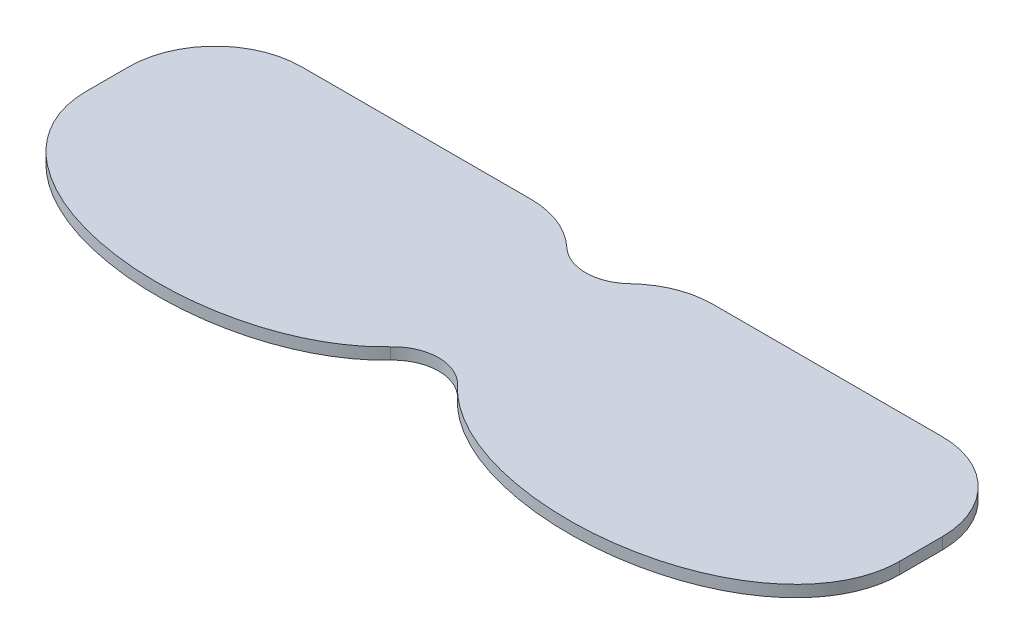
from build123d import *

# Parameters (mm, degrees)
SKETCH4_W                      = 118.3
SKETCH4_H                      = 40.5
BOSS_EXTRUDE1_DEPTH            = 12.7
CUT_EXTRUDE1_DEPTH             = 75.078168174
FILLET1_R                      = 3.175
LPATTERN1_COUNT                = 2
LPATTERN1_PITCH                = 27
FILLET1_OF_LPATTERN1_R         = 3.175
MIRROR1_DEPTH                  = 12.7
SKETCH8_R                      = 0.85
CUT_EXTRUDE2_DEPTH             = 75.078168329
MIRROR3_COPY_1_SKETCH_R        = 0.85
MIRROR3_COPY_1_DEPTH           = 75.078168329
SKETCH14_W                     = 118.3
SKETCH14_H                     = 0.96
SKETCH14_W_2                   = 4.5
SKETCH14_H_2                   = 40.5
CUT_EXTRUDE7_DEPTH             = 0.1
CUT_EXTRUDE8_DEPTH             = 2.35
MIRROR14_COPY_1_DEPTH          = 2.35
MIRROR16_COPY_1_DEPTH          = 2.35
MIRROR16_COPY_2_DEPTH          = 2.35
MIRROR16_COPY_3_DEPTH          = 2.35
CUT_EXTRUDE10_DEPTH            = 75.061089804
SKETCH20_W                     = 127.8
SKETCH20_H                     = 85.5
BOSS_EXTRUDE2_DEPTH            = 3.175
SKETCH22_W                     = 127.8
SKETCH22_H                     = 85.5
CUT_EXTRUDE11_DEPTH            = 78.923440062
CUT_EXTRUDE12_DEPTH            = 77.947080029
F_0_80_TAPPED_HOLE1_D          = 1.19126
MIRROR19_COPY_1_DEPTH          = 77.947080029
MIRROR19_COPY_2_D              = 1.19126
SKETCH26_W                     = 127.8
SKETCH26_H                     = 0.96
CUT_EXTRUDE13_DEPTH            = 3.175
SKETCH27_W                     = 127.8
SKETCH27_H                     = 0.96
CUT_EXTRUDE14_DEPTH            = 3.175
SKETCH29_W                     = 3.175
SKETCH29_H                     = 19.77
CUT_EXTRUDE15_DEPTH            = 0.82
F_0_80_TAPPED_HOLE2_AT_2_COUNT = 2
F_0_80_TAPPED_HOLE2_AT_2_PITCH = 10
SKETCH36_R                     = 0.8
CUT_EXTRUDE16_DEPTH            = 10
FILLET2_R                      = 1.5
FILLET3_R                      = 1.5
F_0_80_TAPPED_HOLE5_AT_2_COUNT = 2
F_0_80_TAPPED_HOLE5_AT_2_PITCH = 10
BOSS_EXTRUDE3_DEPTH            = 0.79375
SKETCH39_W                     = 144.663992048
SKETCH39_H                     = 99.796260463
CUT_EXTRUDE17_DEPTH            = 10
BOSS_EXTRUDE4_DEPTH            = 0.762
SKETCH42_W                     = 65.404927097
SKETCH42_H                     = 32.798348424
CUT_EXTRUDE18_DEPTH            = 10.762


# Read off the part's stored shape, not the designer's step: Mirror1
with BuildPart() as part:
    # Sketch4 → Boss-Extrude1 (new body)
    with BuildSketch(Plane(origin=(0, 0, 0), x_dir=(1, 0, 0), z_dir=(0, 1, 0))):
        with Locations((0, 22.5)):
            Rectangle(SKETCH4_W, SKETCH4_H)
    extrude(amount=BOSS_EXTRUDE1_DEPTH)

    # Sketch5 → Cut-Extrude1 (cut, through all)
    with BuildSketch(Plane(origin=(0, 12.7, 0), x_dir=(1, 0, 0), z_dir=(0, 1, 0))):
        with BuildLine():
            Line((-54.9, 13.5), (-54.9, 7.5))
            Line((-54.9, 7.5), (-33.5, 7.5))
            Line((-33.5, 7.5), (-33.5, 13.5))
            add(Edge.make_bspline(
                [(-33.5, 13.5), (-33.5, 19.5), (-44.2, 19.5), (-54.9, 19.5), (-54.9, 13.5)],
                knots=[3.141592654, 3.141592654, 3.141592654, 4.71238898, 4.71238898, 6.283185307, 6.283185307, 6.283185307], degree=2, weights=[1, 0.707106781, 1, 0.707106781, 1]))
        make_face()
        with BuildLine():
            Line((-54.9, 37.5), (-33.5, 37.5))
            Line((-33.5, 37.5), (-33.5, 31.5))
            add(Edge.make_bspline(
                [(-54.9, 31.5), (-54.9, 25.5), (-44.2, 25.5), (-33.5, 25.5), (-33.5, 31.5)],
                knots=[0, 0, 0, 1.570796327, 1.570796327, 3.141592654, 3.141592654, 3.141592654], degree=2, weights=[1, 0.707106781, 1, 0.707106781, 1]))
            Line((-54.9, 31.5), (-54.9, 37.5))
        make_face()
    cut_extrude1 = extrude(amount=-CUT_EXTRUDE1_DEPTH, mode=Mode.SUBTRACT)

    # Fillet1
    fillet1_edges = [part.edges().sort_by_distance(p)[0] for p in [
        (-33.5, 6.35, -7.5),
        (-54.9, 6.35, -7.5),
        (-54.9, 6.35, -37.5),
        (-33.5, 6.35, -37.5),
    ]]
    fillet(fillet1_edges, radius=FILLET1_R)

    # LPattern1: Cut-Extrude1 ×2
    with Locations(*[(i * LPATTERN1_PITCH, 0, 0) for i in range(1, LPATTERN1_COUNT)]):
        add(cut_extrude1, mode=Mode.SUBTRACT)

    # Fillet1 of LPattern1
    fillet1_of_lpattern1_edges = [part.edges().sort_by_distance(p)[0] for p in [
        (-6.5, 6.35, -7.5),
        (-27.9, 6.35, -7.5),
        (-27.9, 6.35, -37.5),
        (-6.5, 6.35, -37.5),
    ]]
    fillet(fillet1_of_lpattern1_edges, radius=FILLET1_OF_LPATTERN1_R)

    # Mirror1 outline → Mirror1 (cut)
    with BuildSketch(Plane(origin=(0, 0, 0), x_dir=(1, 0, 0), z_dir=(0, 1, 0))):
        with BuildLine():
            add(Edge.make_bspline(
                [(33.5, 13.5), (33.5, 19.5), (44.2, 19.5), (54.9, 19.5), (54.9, 13.5)],
                knots=[3.141592654, 3.141592654, 3.141592654, 4.71238898, 4.71238898, 6.283185307, 6.283185307, 6.283185307], degree=2, weights=[1, 0.707106781, 1, 0.707106781, 1]))
            Line((33.5, 13.5), (33.5, 10.675))
            ThreePointArc((33.5, 10.675), (34.42993597, 8.42993597), (36.675, 7.5))
            Line((36.675, 7.5), (51.725, 7.5))
            ThreePointArc((51.725, 7.5), (53.97006403, 8.42993597), (54.9, 10.675))
            Line((54.9, 10.675), (54.9, 13.5))
        make_face()
        with BuildLine():
            add(Edge.make_bspline(
                [(54.9, 31.5), (54.9, 25.5), (44.2, 25.5), (33.5, 25.5), (33.5, 31.5)],
                knots=[0, 0, 0, 1.570796327, 1.570796327, 3.141592654, 3.141592654, 3.141592654], degree=2, weights=[1, 0.707106781, 1, 0.707106781, 1]))
            Line((54.9, 31.5), (54.9, 34.325))
            ThreePointArc((54.9, 34.325), (53.97006403, 36.57006403), (51.725, 37.5))
            Line((51.725, 37.5), (36.675, 37.5))
            ThreePointArc((36.675, 37.5), (34.42993597, 36.57006403), (33.5, 34.325))
            Line((33.5, 34.325), (33.5, 31.5))
        make_face()
        with BuildLine():
            add(Edge.make_bspline(
                [(6.5, 13.5), (6.5, 19.5), (17.2, 19.5), (27.9, 19.5), (27.9, 13.5)],
                knots=[3.141592654, 3.141592654, 3.141592654, 4.71238898, 4.71238898, 6.283185307, 6.283185307, 6.283185307], degree=2, weights=[1, 0.707106781, 1, 0.707106781, 1]))
            Line((6.5, 13.5), (6.5, 10.675))
            ThreePointArc((6.5, 10.675), (7.42993597, 8.42993597), (9.675, 7.5))
            Line((9.675, 7.5), (24.725, 7.5))
            ThreePointArc((24.725, 7.5), (26.97006403, 8.42993597), (27.9, 10.675))
            Line((27.9, 10.675), (27.9, 13.5))
        make_face()
        with BuildLine():
            add(Edge.make_bspline(
                [(27.9, 31.5), (27.9, 25.5), (17.2, 25.5), (6.5, 25.5), (6.5, 31.5)],
                knots=[0, 0, 0, 1.570796327, 1.570796327, 3.141592654, 3.141592654, 3.141592654], degree=2, weights=[1, 0.707106781, 1, 0.707106781, 1]))
            Line((27.9, 31.5), (27.9, 34.325))
            ThreePointArc((27.9, 34.325), (26.97006403, 36.57006403), (24.725, 37.5))
            Line((24.725, 37.5), (9.675, 37.5))
            ThreePointArc((9.675, 37.5), (7.42993597, 36.57006403), (6.5, 34.325))
            Line((6.5, 34.325), (6.5, 31.5))
        make_face()
    extrude(amount=MIRROR1_DEPTH, mode=Mode.SUBTRACT)

    # Sketch8 → Cut-Extrude2 (cut, through all)
    with BuildSketch(Plane(origin=(0, 12.7, 0), x_dir=(1, 0, 0), z_dir=(0, 1, 0))):
        with Locations(Location((-57.15, 40.75, 0), (0, 0, 270))):
            Circle(SKETCH8_R)
        with Locations(Location((-30.7, 40.75, 0), (0, 0, 270))):
            Circle(SKETCH8_R)
        with Locations(Location((-4.25, 40.75, 0), (0, 0, 270))):
            Circle(SKETCH8_R)
        with Locations(Location((-4.25, 24.98, 0), (0, 0, 270))):
            Circle(SKETCH8_R)
        with Locations(Location((-30.7, 24.98, 0), (0, 0, 270))):
            Circle(SKETCH8_R)
        with Locations(Location((-57.15, 24.98, 0), (0, 0, 270))):
            Circle(SKETCH8_R)
    cut_extrude2 = extrude(amount=-CUT_EXTRUDE2_DEPTH, mode=Mode.SUBTRACT)

    # Mirror2: Cut-Extrude2 across plane
    add(cut_extrude2.mirror(Plane.XY.offset(-22.5)), mode=Mode.SUBTRACT)

    # Mirror3: Cut-Extrude2 across plane
    add(cut_extrude2.mirror(Plane(origin=(0, 0, 0), x_dir=(0, 0, 1), z_dir=(1, 0, 0))), mode=Mode.SUBTRACT)

    # Mirror3 copy 1 sketch → Mirror3 copy 1 (cut, through all)
    with BuildSketch(Plane(origin=(0, 12.7, -45), x_dir=(-1, 0, 0), z_dir=(0, 1, 0))):
        with Locations(Location((-57.15, 40.75, 0), (0, 0, 270))):
            Circle(MIRROR3_COPY_1_SKETCH_R)
        with Locations(Location((-30.7, 40.75, 0), (0, 0, 270))):
            Circle(MIRROR3_COPY_1_SKETCH_R)
        with Locations(Location((-4.25, 40.75, 0), (0, 0, 270))):
            Circle(MIRROR3_COPY_1_SKETCH_R)
        with Locations(Location((-4.25, 24.98, 0), (0, 0, 270))):
            Circle(MIRROR3_COPY_1_SKETCH_R)
        with Locations(Location((-30.7, 24.98, 0), (0, 0, 270))):
            Circle(MIRROR3_COPY_1_SKETCH_R)
        with Locations(Location((-57.15, 24.98, 0), (0, 0, 270))):
            Circle(MIRROR3_COPY_1_SKETCH_R)
    extrude(amount=-MIRROR3_COPY_1_DEPTH, mode=Mode.SUBTRACT)

    # Sketch14 → Cut-Extrude7 (cut)
    with BuildSketch(Plane(origin=(0, 12.7, 0), x_dir=(1, 0, 0), z_dir=(0, 1, 0))):
        with Locations((0, 22.5)):
            Rectangle(SKETCH14_W, SKETCH14_H)
        with Locations((0, 22.5)):
            Rectangle(SKETCH14_W_2, SKETCH14_H_2)
    extrude(amount=-CUT_EXTRUDE7_DEPTH, mode=Mode.SUBTRACT)

    # Sketch15 → Cut-Extrude8 (cut)
    with BuildSketch(Plane(origin=(0, 12.7, 0), x_dir=(1, 0, 0), z_dir=(0, 1, 0))):
        with BuildLine():
            Line((-33.875, 42.75), (-27.525, 42.75))
            Line((-27.525, 42.75), (-27.525, 41.5))
            ThreePointArc((-27.525, 41.5), (-30.7, 38.325), (-33.875, 41.5))
            Line((-33.875, 41.5), (-33.875, 42.75))
        make_face()
        with BuildLine():
            Line((-2.25, 42.75), (-6.675, 42.75))
            Line((-6.675, 42.75), (-6.675, 41.5))
            ThreePointArc((-6.675, 41.5), (-5.74506403, 39.25493597), (-3.5, 38.325))
            Line((-3.5, 38.325), (-2.25, 38.325))
            Line((-2.25, 38.325), (-2.25, 42.75))
        make_face()
        with BuildLine():
            Line((-59.15, 42.75), (-54.725, 42.75))
            Line((-54.725, 42.75), (-54.725, 41.5))
            ThreePointArc((-54.725, 41.5), (-55.65493597, 39.25493597), (-57.9, 38.325))
            Line((-57.9, 38.325), (-59.15, 38.325))
            Line((-59.15, 38.325), (-59.15, 42.75))
        make_face()
    cut_extrude8 = extrude(amount=-CUT_EXTRUDE8_DEPTH, mode=Mode.SUBTRACT)

    # Mirror6: Cut-Extrude8 across plane
    add(cut_extrude8.mirror(Plane(origin=(0, 0, -32.865), x_dir=(1, 0, 0), z_dir=(0, 0, -1))), mode=Mode.SUBTRACT)

    # Mirror14: Cut-Extrude8 across plane
    add(cut_extrude8.mirror(Plane(origin=(0, 0, 0), x_dir=(0, 0, 1), z_dir=(1, 0, 0))), mode=Mode.SUBTRACT)

    # Mirror14 copy 1 sketch → Mirror14 copy 1 (cut)
    with BuildSketch(Plane(origin=(0, 12.7, -65.73), x_dir=(-1, 0, 0), z_dir=(0, 1, 0))):
        with BuildLine():
            Line((-33.875, 42.75), (-27.525, 42.75))
            Line((-27.525, 42.75), (-27.525, 41.5))
            ThreePointArc((-27.525, 41.5), (-30.7, 38.325), (-33.875, 41.5))
            Line((-33.875, 41.5), (-33.875, 42.75))
        make_face()
        with BuildLine():
            Line((-2.25, 42.75), (-6.675, 42.75))
            Line((-6.675, 42.75), (-6.675, 41.5))
            ThreePointArc((-6.675, 41.5), (-5.74506403, 39.25493597), (-3.5, 38.325))
            Line((-3.5, 38.325), (-2.25, 38.325))
            Line((-2.25, 38.325), (-2.25, 42.75))
        make_face()
        with BuildLine():
            Line((-59.15, 42.75), (-54.725, 42.75))
            Line((-54.725, 42.75), (-54.725, 41.5))
            ThreePointArc((-54.725, 41.5), (-55.65493597, 39.25493597), (-57.9, 38.325))
            Line((-57.9, 38.325), (-59.15, 38.325))
            Line((-59.15, 38.325), (-59.15, 42.75))
        make_face()
    extrude(amount=-MIRROR14_COPY_1_DEPTH, mode=Mode.SUBTRACT)

    # Mirror16: Cut-Extrude8 across plane
    add(cut_extrude8.mirror(Plane.XY.offset(-22.5)), mode=Mode.SUBTRACT)

    # Mirror16 copy 1 sketch → Mirror16 copy 1 (cut)
    with BuildSketch(Plane(origin=(0, 12.7, 20.73), x_dir=(1, 0, 0), z_dir=(0, 1, 0))):
        with BuildLine():
            Line((-33.875, 42.75), (-27.525, 42.75))
            Line((-27.525, 42.75), (-27.525, 41.5))
            ThreePointArc((-27.525, 41.5), (-30.7, 38.325), (-33.875, 41.5))
            Line((-33.875, 41.5), (-33.875, 42.75))
        make_face()
        with BuildLine():
            Line((-2.25, 42.75), (-6.675, 42.75))
            Line((-6.675, 42.75), (-6.675, 41.5))
            ThreePointArc((-6.675, 41.5), (-5.74506403, 39.25493597), (-3.5, 38.325))
            Line((-3.5, 38.325), (-2.25, 38.325))
            Line((-2.25, 38.325), (-2.25, 42.75))
        make_face()
        with BuildLine():
            Line((-59.15, 42.75), (-54.725, 42.75))
            Line((-54.725, 42.75), (-54.725, 41.5))
            ThreePointArc((-54.725, 41.5), (-55.65493597, 39.25493597), (-57.9, 38.325))
            Line((-57.9, 38.325), (-59.15, 38.325))
            Line((-59.15, 38.325), (-59.15, 42.75))
        make_face()
    extrude(amount=-MIRROR16_COPY_1_DEPTH, mode=Mode.SUBTRACT)

    # Mirror16 copy 2 sketch → Mirror16 copy 2 (cut)
    with BuildSketch(Plane(origin=(0, 12.7, -45), x_dir=(-1, 0, 0), z_dir=(0, 1, 0))):
        with BuildLine():
            Line((-33.875, 42.75), (-27.525, 42.75))
            Line((-27.525, 42.75), (-27.525, 41.5))
            ThreePointArc((-27.525, 41.5), (-30.7, 38.325), (-33.875, 41.5))
            Line((-33.875, 41.5), (-33.875, 42.75))
        make_face()
        with BuildLine():
            Line((-2.25, 42.75), (-6.675, 42.75))
            Line((-6.675, 42.75), (-6.675, 41.5))
            ThreePointArc((-6.675, 41.5), (-5.74506403, 39.25493597), (-3.5, 38.325))
            Line((-3.5, 38.325), (-2.25, 38.325))
            Line((-2.25, 38.325), (-2.25, 42.75))
        make_face()
        with BuildLine():
            Line((-59.15, 42.75), (-54.725, 42.75))
            Line((-54.725, 42.75), (-54.725, 41.5))
            ThreePointArc((-54.725, 41.5), (-55.65493597, 39.25493597), (-57.9, 38.325))
            Line((-57.9, 38.325), (-59.15, 38.325))
            Line((-59.15, 38.325), (-59.15, 42.75))
        make_face()
    extrude(amount=-MIRROR16_COPY_2_DEPTH, mode=Mode.SUBTRACT)

    # Mirror16 copy 3 sketch → Mirror16 copy 3 (cut)
    with BuildSketch(Plane(origin=(0, 12.7, 20.73), x_dir=(-1, 0, 0), z_dir=(0, 1, 0))):
        with BuildLine():
            Line((-33.875, -42.75), (-27.525, -42.75))
            Line((-27.525, -42.75), (-27.525, -41.5))
            ThreePointArc((-27.525, -41.5), (-30.7, -38.325), (-33.875, -41.5))
            Line((-33.875, -41.5), (-33.875, -42.75))
        make_face()
        with BuildLine():
            Line((-2.25, -42.75), (-6.675, -42.75))
            Line((-6.675, -42.75), (-6.675, -41.5))
            ThreePointArc((-6.675, -41.5), (-5.74506403, -39.25493597), (-3.5, -38.325))
            Line((-3.5, -38.325), (-2.25, -38.325))
            Line((-2.25, -38.325), (-2.25, -42.75))
        make_face()
        with BuildLine():
            Line((-59.15, -42.75), (-54.725, -42.75))
            Line((-54.725, -42.75), (-54.725, -41.5))
            ThreePointArc((-54.725, -41.5), (-55.65493597, -39.25493597), (-57.9, -38.325))
            Line((-57.9, -38.325), (-59.15, -38.325))
            Line((-59.15, -38.325), (-59.15, -42.75))
        make_face()
    extrude(amount=-MIRROR16_COPY_3_DEPTH, mode=Mode.SUBTRACT)

    # Sketch17 → Cut-Extrude10 (cut, through all)
    with BuildSketch(Plane(origin=(0, 12.6, 0), x_dir=(1, 0, 0), z_dir=(0, 1, 0))):
        Polygon((-54.725, 22.98), (-59.15, 22.98), (-59.15, 22.02), (-54.725, 22.02), (-33.875, 22.02), (-27.525, 22.02), (-6.675, 22.02), (-2.25, 22.02), (-2.25, 17.595), (-2.25, 6.675), (-2.25, 2.25), (2.25, 2.25), (2.25, 6.675), (2.25, 17.595), (2.25, 22.02), (6.675, 22.02), (27.525, 22.02), (33.875, 22.02), (54.725, 22.02), (59.15, 22.02), (59.15, 22.98), (54.725, 22.98), (33.875, 22.98), (27.525, 22.98), (6.675, 22.98), (2.25, 22.98), (2.25, 27.405), (2.25, 38.325), (2.25, 42.75), (-2.25, 42.75), (-2.25, 38.325), (-2.25, 27.405), (-2.25, 22.98), (-6.675, 22.98), (-27.525, 22.98), (-33.875, 22.98), align=None)
    extrude(amount=-CUT_EXTRUDE10_DEPTH, mode=Mode.SUBTRACT)


with BuildPart() as cut_extrude10_piece_1:
    # of the separate pieces the step leaves, piece 1, a body of its own (cut_extrude10_pieces)
    add(part.part.solids().sort_by_distance((59.15, 0, -22.02))[0])



with BuildPart() as cut_extrude10_piece_2:
    # of the separate pieces the step leaves, piece 2, a body of its own (cut_extrude10_pieces)
    add(part.part.solids().sort_by_distance((2.25, 0, -42.75))[0])


with BuildPart() as cut_extrude10_piece_3:
    # of the separate pieces the step leaves, piece 3, a body of its own (cut_extrude10_pieces)
    add(part.part.solids().sort_by_distance((-59.15, 0, -2.25))[0])


with BuildPart() as cut_extrude10_piece_4:
    # of the separate pieces the step leaves, piece 4, a body of its own (cut_extrude10_pieces)
    add(part.part.solids().sort_by_distance((-59.15, 0, -22.98))[0])


with BuildPart() as cut_extrude10_piece_1_1:
    add(cut_extrude10_piece_1.part)

    add(cut_extrude10_piece_2.part)  # Boss-Extrude2 merges Cut-Extrude10 piece 2

    add(cut_extrude10_piece_3.part)  # Boss-Extrude2 merges Cut-Extrude10 piece 3

    add(cut_extrude10_piece_4.part)  # Boss-Extrude2 merges Cut-Extrude10 piece 4
    # Sketch20 → Boss-Extrude2 (add)
    with BuildSketch(Plane(origin=(0, 0, 0), x_dir=(1, 0, 0), z_dir=(0, 1, 0))):
        Rectangle(SKETCH20_W, SKETCH20_H)
    extrude(amount=-BOSS_EXTRUDE2_DEPTH)

    # Sketch22 → Cut-Extrude11 (cut, through all)
    with BuildSketch(Plane(origin=(0, 0, 0), x_dir=(1, 0, 0), z_dir=(0, 1, 0))):
        Rectangle(SKETCH22_W, SKETCH22_H)
    extrude(amount=CUT_EXTRUDE11_DEPTH, mode=Mode.SUBTRACT)

    # Sketch23 → Cut-Extrude12 (cut, through all)
    with BuildSketch(Plane(origin=(0, 0, 0), x_dir=(1, 0, 0), z_dir=(0, 1, 0))):
        with BuildLine():
            Line((-36.675, 37.5), (-51.725, 37.5))
            ThreePointArc((-51.725, 37.5), (-53.97006403, 36.57006403), (-54.9, 34.325))
            Line((-54.9, 34.325), (-54.9, 31.5))
            add(Edge.make_bspline(
                [(-54.9, 31.5), (-54.9, 25.5), (-44.2, 25.5), (-33.5, 25.5), (-33.5, 31.5)],
                knots=[0, 0, 0, 1.570796327, 1.570796327, 3.141592654, 3.141592654, 3.141592654], degree=2, weights=[1, 0.707106781, 1, 0.707106781, 1]))
            Line((-33.5, 31.5), (-33.5, 34.325))
            ThreePointArc((-33.5, 34.325), (-34.42993597, 36.57006403), (-36.675, 37.5))
        make_face()
        with BuildLine():
            Line((-9.675, 37.5), (-24.725, 37.5))
            ThreePointArc((-24.725, 37.5), (-26.97006403, 36.57006403), (-27.9, 34.325))
            Line((-27.9, 34.325), (-27.9, 31.5))
            add(Edge.make_bspline(
                [(-27.9, 31.5), (-27.9, 25.5), (-17.2, 25.5), (-6.5, 25.5), (-6.5, 31.5)],
                knots=[0, 0, 0, 1.570796327, 1.570796327, 3.141592654, 3.141592654, 3.141592654], degree=2, weights=[1, 0.707106781, 1, 0.707106781, 1]))
            Line((-6.5, 31.5), (-6.5, 34.325))
            ThreePointArc((-6.5, 34.325), (-7.42993597, 36.57006403), (-9.675, 37.5))
        make_face()
        with BuildLine():
            Line((-54.9, 13.5), (-54.9, 10.675))
            ThreePointArc((-54.9, 10.675), (-53.97006403, 8.42993597), (-51.725, 7.5))
            Line((-51.725, 7.5), (-36.675, 7.5))
            ThreePointArc((-36.675, 7.5), (-34.42993597, 8.42993597), (-33.5, 10.675))
            Line((-33.5, 10.675), (-33.5, 13.5))
            add(Edge.make_bspline(
                [(-33.5, 13.5), (-33.5, 19.5), (-44.2, 19.5), (-54.9, 19.5), (-54.9, 13.5)],
                knots=[3.141592654, 3.141592654, 3.141592654, 4.71238898, 4.71238898, 6.283185307, 6.283185307, 6.283185307], degree=2, weights=[1, 0.707106781, 1, 0.707106781, 1]))
        make_face()
        with BuildLine():
            Line((-27.9, 13.5), (-27.9, 10.675))
            ThreePointArc((-27.9, 10.675), (-26.97006403, 8.42993597), (-24.725, 7.5))
            Line((-24.725, 7.5), (-9.675, 7.5))
            ThreePointArc((-9.675, 7.5), (-7.42993597, 8.42993597), (-6.5, 10.675))
            Line((-6.5, 10.675), (-6.5, 13.5))
            add(Edge.make_bspline(
                [(-6.5, 13.5), (-6.5, 19.5), (-17.2, 19.5), (-27.9, 19.5), (-27.9, 13.5)],
                knots=[3.141592654, 3.141592654, 3.141592654, 4.71238898, 4.71238898, 6.283185307, 6.283185307, 6.283185307], degree=2, weights=[1, 0.707106781, 1, 0.707106781, 1]))
        make_face()
    cut_extrude12 = extrude(amount=-CUT_EXTRUDE12_DEPTH, mode=Mode.SUBTRACT)

    # #0-80 Tapped Hole1 (through all)
    with Locations(Plane(origin=(0, 0, 0), x_dir=(1, 0, 0), z_dir=(0, 1, 0))):
        with Locations((-57.15, 40.75), (-30.7, 40.75), (-4.25, 40.75), (-4.25, 24.98), (-30.7, 24.98), (-30.7, 20.02), (-57.15, 24.98), (-57.15, 20.02), (-4.25, 20.02), (-4.25, 4.25), (-30.7, 4.25), (-57.15, 4.25)):
            f_0_80_tapped_hole1 = Hole(F_0_80_TAPPED_HOLE1_D / 2)

    # Mirror18: Cut-Extrude12, #0-80 Tapped Hole1 across plane
    add(cut_extrude12.mirror(Plane(origin=(0, 0, 0), x_dir=(0, 0, 1), z_dir=(1, 0, 0))), mode=Mode.SUBTRACT)
    add(f_0_80_tapped_hole1.mirror(Plane(origin=(0, 0, 0), x_dir=(0, 0, 1), z_dir=(1, 0, 0))), mode=Mode.SUBTRACT)

    # Mirror19: Cut-Extrude12, #0-80 Tapped Hole1 across plane
    add(cut_extrude12.mirror(Plane(origin=(0, 0, 0), x_dir=(1, 0, 0), z_dir=(0, 0, -1))), mode=Mode.SUBTRACT)
    add(f_0_80_tapped_hole1.mirror(Plane(origin=(0, 0, 0), x_dir=(1, 0, 0), z_dir=(0, 0, -1))), mode=Mode.SUBTRACT)

    # Mirror19 copy 1 sketch → Mirror19 copy 1 (cut, through all)
    with BuildSketch(Plane(origin=(0, 0, 0), x_dir=(-1, 0, 0), z_dir=(0, 1, 0))):
        with BuildLine():
            Line((-36.675, 37.5), (-51.725, 37.5))
            ThreePointArc((-51.725, 37.5), (-53.97006403, 36.57006403), (-54.9, 34.325))
            Line((-54.9, 34.325), (-54.9, 31.5))
            add(Edge.make_bspline(
                [(-54.9, 31.5), (-54.9, 25.5), (-44.2, 25.5), (-33.5, 25.5), (-33.5, 31.5)],
                knots=[0, 0, 0, 1.570796327, 1.570796327, 3.141592654, 3.141592654, 3.141592654], degree=2, weights=[1, 0.707106781, 1, 0.707106781, 1]))
            Line((-33.5, 31.5), (-33.5, 34.325))
            ThreePointArc((-33.5, 34.325), (-34.42993597, 36.57006403), (-36.675, 37.5))
        make_face()
        with BuildLine():
            Line((-9.675, 37.5), (-24.725, 37.5))
            ThreePointArc((-24.725, 37.5), (-26.97006403, 36.57006403), (-27.9, 34.325))
            Line((-27.9, 34.325), (-27.9, 31.5))
            add(Edge.make_bspline(
                [(-27.9, 31.5), (-27.9, 25.5), (-17.2, 25.5), (-6.5, 25.5), (-6.5, 31.5)],
                knots=[0, 0, 0, 1.570796327, 1.570796327, 3.141592654, 3.141592654, 3.141592654], degree=2, weights=[1, 0.707106781, 1, 0.707106781, 1]))
            Line((-6.5, 31.5), (-6.5, 34.325))
            ThreePointArc((-6.5, 34.325), (-7.42993597, 36.57006403), (-9.675, 37.5))
        make_face()
        with BuildLine():
            Line((-54.9, 13.5), (-54.9, 10.675))
            ThreePointArc((-54.9, 10.675), (-53.97006403, 8.42993597), (-51.725, 7.5))
            Line((-51.725, 7.5), (-36.675, 7.5))
            ThreePointArc((-36.675, 7.5), (-34.42993597, 8.42993597), (-33.5, 10.675))
            Line((-33.5, 10.675), (-33.5, 13.5))
            add(Edge.make_bspline(
                [(-33.5, 13.5), (-33.5, 19.5), (-44.2, 19.5), (-54.9, 19.5), (-54.9, 13.5)],
                knots=[3.141592654, 3.141592654, 3.141592654, 4.71238898, 4.71238898, 6.283185307, 6.283185307, 6.283185307], degree=2, weights=[1, 0.707106781, 1, 0.707106781, 1]))
        make_face()
        with BuildLine():
            Line((-27.9, 13.5), (-27.9, 10.675))
            ThreePointArc((-27.9, 10.675), (-26.97006403, 8.42993597), (-24.725, 7.5))
            Line((-24.725, 7.5), (-9.675, 7.5))
            ThreePointArc((-9.675, 7.5), (-7.42993597, 8.42993597), (-6.5, 10.675))
            Line((-6.5, 10.675), (-6.5, 13.5))
            add(Edge.make_bspline(
                [(-6.5, 13.5), (-6.5, 19.5), (-17.2, 19.5), (-27.9, 19.5), (-27.9, 13.5)],
                knots=[3.141592654, 3.141592654, 3.141592654, 4.71238898, 4.71238898, 6.283185307, 6.283185307, 6.283185307], degree=2, weights=[1, 0.707106781, 1, 0.707106781, 1]))
        make_face()
    extrude(amount=-MIRROR19_COPY_1_DEPTH, mode=Mode.SUBTRACT)

    # Mirror19 copy 2 (through all)
    with Locations(Plane(origin=(0, 0, 0), x_dir=(-1, 0, 0), z_dir=(0, 1, 0))):
        with Locations((-57.15, 40.75), (-30.7, 40.75), (-4.25, 40.75), (-4.25, 24.98), (-30.7, 24.98), (-30.7, 20.02), (-57.15, 24.98), (-57.15, 20.02), (-4.25, 20.02), (-4.25, 4.25), (-30.7, 4.25), (-57.15, 4.25)):
            Hole(MIRROR19_COPY_2_D / 2)

    # Sketch26 → Cut-Extrude13 (cut)
    with BuildSketch(Plane(origin=(0, 0, 0), x_dir=(1, 0, 0), z_dir=(0, 1, 0))):
        with Locations((0, 22.5)):
            Rectangle(SKETCH26_W, SKETCH26_H)
    extrude(amount=-CUT_EXTRUDE13_DEPTH, mode=Mode.SUBTRACT)


with BuildPart() as cut_extrude13_piece_1:
    # of the separate pieces the step leaves, piece 1, a body of its own (cut_extrude13_pieces)
    add(cut_extrude10_piece_1_1.part.solids().sort_by_distance((63.9, 0, -22.02))[0])

    # Sketch27 → Cut-Extrude14 (cut)
    with BuildSketch(Plane(origin=(0, 0, 0), x_dir=(1, 0, 0), z_dir=(0, 1, 0))):
        with Locations((0, -22.5)):
            Rectangle(SKETCH27_W, SKETCH27_H)
    extrude(amount=-CUT_EXTRUDE14_DEPTH, mode=Mode.SUBTRACT)


with BuildPart() as cut_extrude13_piece_2:
    # of the separate pieces the step leaves, piece 2, a body of its own (cut_extrude13_pieces)
    add(cut_extrude10_piece_1_1.part.solids().sort_by_distance((-63.9, 0, -42.75))[0])


with BuildPart() as cut_extrude14_piece_1:
    # of the separate pieces the step leaves, piece 1, a body of its own (cut_extrude14_pieces)
    add(cut_extrude13_piece_1.part.solids().sort_by_distance((63.9, 0, -22.02))[0])

    # Sketch30 → #0-80 Tapped Hole2 (revolve, cut)
    with BuildSketch(Plane(origin=(62.3125, 0, -5), x_dir=(0, 0, 1), z_dir=(1, 0, 0))):
        Polygon((0, 0), (0, 8.287890611), (0.59563, 7.93), (0.59563, 0), align=None)
    f_0_80_tapped_hole2 = revolve(axis=Axis((62.3125, 6.35, -5), (0, -1, 0)), mode=Mode.SUBTRACT)

    # #0-80 Tapped Hole2 at 2: #0-80 Tapped Hole2 ×2
    with Locations(*[(0, 0, i * F_0_80_TAPPED_HOLE2_AT_2_PITCH) for i in range(1, F_0_80_TAPPED_HOLE2_AT_2_COUNT)]):
        add(f_0_80_tapped_hole2, mode=Mode.SUBTRACT)


with BuildPart() as cut_extrude14_piece_2:
    # of the separate pieces the step leaves, piece 2, a body of its own (cut_extrude14_pieces)
    add(cut_extrude13_piece_1.part.solids().sort_by_distance((63.9, 0, 22.98))[0])


with BuildPart() as cut_extrude15_tool:
    # Sketch29 → Cut-Extrude15 (new body)
    with BuildSketch(Plane.XZ.offset(3.175)):
        with Locations((62.3125, -32.865)):
            Rectangle(SKETCH29_W, SKETCH29_H)
        with Locations((62.3125, 32.865)):
            Rectangle(SKETCH29_W, SKETCH29_H)
    cut_extrude15 = extrude(amount=-CUT_EXTRUDE15_DEPTH)


with BuildPart() as cut_extrude13_piece_2_1:
    add(cut_extrude13_piece_2.part)

    # Cut-Extrude15: cut by cut_extrude15_tool
    add(cut_extrude15_tool.part, mode=Mode.SUBTRACT)


with BuildPart() as cut_extrude14_piece_2_1:
    add(cut_extrude14_piece_2.part)

    # Cut-Extrude15: cut by cut_extrude15_tool
    add(cut_extrude15_tool.part, mode=Mode.SUBTRACT)


with BuildPart() as cut_extrude16_tool:
    # Sketch36 → Cut-Extrude16 (new body)
    with BuildSketch(Plane.XZ.offset(2.355)):
        with Locations(Location((62.3125, 37.98, 0), (0, 0, 270))):
            Circle(SKETCH36_R)
        with Locations(Location((62.3125, 25.98, 0), (0, 0, 270))):
            Circle(SKETCH36_R)
        with Locations(Location((62.3125, -25.98, 0), (0, 0, 270))):
            Circle(SKETCH36_R)
        with Locations(Location((62.3125, -37.98, 0), (0, 0, 270))):
            Circle(SKETCH36_R)
    cut_extrude16 = extrude(amount=-CUT_EXTRUDE16_DEPTH)


with BuildPart() as cut_extrude13_piece_2_2:
    add(cut_extrude13_piece_2_1.part)

    # Cut-Extrude16: cut by cut_extrude16_tool
    add(cut_extrude16_tool.part, mode=Mode.SUBTRACT)


with BuildPart() as cut_extrude14_piece_2_2:
    add(cut_extrude14_piece_2_1.part)

    # Cut-Extrude16: cut by cut_extrude16_tool
    add(cut_extrude16_tool.part, mode=Mode.SUBTRACT)


with BuildPart() as mirror20_tool:
    # Mirror20: Cut-Extrude15, #0-80 Tapped Hole2, Cut-Extrude16 across plane
    add(cut_extrude15.mirror(Plane(origin=(0, 0, 0), x_dir=(0, 0, 1), z_dir=(1, 0, 0))))
    add(f_0_80_tapped_hole2.mirror(Plane(origin=(0, 0, 0), x_dir=(0, 0, 1), z_dir=(1, 0, 0))))
    add(cut_extrude16.mirror(Plane(origin=(0, 0, 0), x_dir=(0, 0, 1), z_dir=(1, 0, 0))))


with BuildPart() as cut_extrude13_piece_2_3:
    add(cut_extrude13_piece_2_2.part)

    # Mirror20: cut by mirror20_tool
    add(mirror20_tool.part, mode=Mode.SUBTRACT)

    # Fillet2
    fillet2_edges = [cut_extrude13_piece_2_3.edges().sort_by_distance(p)[0] for p in [
        (-63.9, -1.1775, -42.75),
        (63.9, -1.1775, -42.75),
    ]]
    fillet(fillet2_edges, radius=FILLET2_R)

    # Sketch28 → Boss-Extrude3 (add)
    with BuildSketch(Plane(origin=(0, 0, 0), x_dir=(1, 0, 0), z_dir=(0, 1, 0))):
        with BuildLine():
            Line((-36.675, 40), (-51.725, 40))
            ThreePointArc((-51.725, 40), (-55.737830983, 38.337830983), (-57.4, 34.325))
            Line((-57.4, 34.325), (-57.4, 31.5))
            add(Edge.make_bspline(
                [(-57.4, 31.5), (-57.4, 30.821154279), (-57.153175896, 29.447143081), (-56.167212938, 27.665270484), (-54.756272745, 26.202813776), (-52.455453984, 24.642995601), (-48.951428942, 23.350815489), (-44.2, 22.824592255), (-39.448571058, 23.350815489), (-35.944546016, 24.642995601), (-34.049903108, 25.927450724), (-33.266838465, 26.626794184), (-33.008008702, 26.88800086), (-32.892921678, 27.01127891)],
                knots=[0, 0, 0, 0, 0.196349541, 0.392699082, 0.589048623, 0.785398163, 1.178097245, 1.570796327, 1.963495408, 2.35619449, 2.552544031, 2.61024303, 2.659330415, 2.659330415, 2.659330415, 2.659330415], degree=3))
            ThreePointArc((-32.892921678, 27.01127891), (-30.7, 27.964062625), (-28.507078322, 27.01127891))
            add(Edge.make_bspline(
                [(-28.507078322, 27.01127891), (-28.391991298, 26.88800086), (-28.133161535, 26.626794184), (-27.350096892, 25.927450724), (-25.455453984, 24.642995601), (-21.951428942, 23.350815489), (-17.2, 22.824592255), (-12.448571058, 23.350815489), (-8.944546016, 24.642995601), (-6.643727255, 26.202813776), (-5.232787062, 27.665270484), (-4.246824104, 29.447143081), (-4, 30.821154279), (-4, 31.5)],
                knots=[0.482262239, 0.482262239, 0.482262239, 0.482262239, 0.531349624, 0.589048623, 0.785398163, 1.178097245, 1.570796327, 1.963495408, 2.35619449, 2.552544031, 2.748893572, 2.945243113, 3.141592654, 3.141592654, 3.141592654, 3.141592654], degree=3))
            Line((-4, 31.5), (-4, 34.325))
            ThreePointArc((-4, 34.325), (-5.662169017, 38.337830983), (-9.675, 40))
            Line((-9.675, 40), (-24.725, 40))
            ThreePointArc((-24.725, 40), (-26.829389725, 39.595405002), (-28.633717579, 38.439310621))
            ThreePointArc((-28.633717579, 38.439310621), (-30.7, 37.614276588), (-32.766282421, 38.439310621))
            ThreePointArc((-32.766282421, 38.439310621), (-34.570610275, 39.595405002), (-36.675, 40))
        make_face()
        with BuildLine():
            Line((-33.5, 31.5), (-33.5, 34.325))
            ThreePointArc((-33.5, 34.325), (-34.42993597, 36.57006403), (-36.675, 37.5))
            Line((-36.675, 37.5), (-51.725, 37.5))
            ThreePointArc((-51.725, 37.5), (-53.97006403, 36.57006403), (-54.9, 34.325))
            Line((-54.9, 34.325), (-54.9, 31.5))
            add(Edge.make_bspline(
                [(-54.9, 31.5), (-54.9, 25.5), (-44.2, 25.5), (-33.5, 25.5), (-33.5, 31.5)],
                knots=[0, 0, 0, 1.570796327, 1.570796327, 3.141592654, 3.141592654, 3.141592654], degree=2, weights=[1, 0.707106781, 1, 0.707106781, 1]))
        make_face(mode=Mode.SUBTRACT)
        with BuildLine():
            Line((-9.675, 37.5), (-24.725, 37.5))
            ThreePointArc((-24.725, 37.5), (-26.97006403, 36.57006403), (-27.9, 34.325))
            Line((-27.9, 34.325), (-27.9, 31.5))
            add(Edge.make_bspline(
                [(-27.9, 31.5), (-27.9, 25.5), (-17.2, 25.5), (-6.5, 25.5), (-6.5, 31.5)],
                knots=[0, 0, 0, 1.570796327, 1.570796327, 3.141592654, 3.141592654, 3.141592654], degree=2, weights=[1, 0.707106781, 1, 0.707106781, 1]))
            Line((-6.5, 31.5), (-6.5, 34.325))
            ThreePointArc((-6.5, 34.325), (-7.42993597, 36.57006403), (-9.675, 37.5))
        make_face(mode=Mode.SUBTRACT)
    extrude(amount=BOSS_EXTRUDE3_DEPTH)


with BuildPart() as cut_extrude14_piece_1_1:
    add(cut_extrude14_piece_1.part)

    # Mirror20: cut by mirror20_tool
    add(mirror20_tool.part, mode=Mode.SUBTRACT)

    # Mirror20 copy 1 sketch → Mirror20 copy 1 (revolve, cut)
    with BuildSketch(Plane(origin=(-62.3125, 0, 5), x_dir=(0, 0, 1), z_dir=(-1, 0, 0))):
        Polygon((0, 0), (0, -8.287890611), (0.59563, -7.93), (0.59563, 0), align=None)
    revolve(axis=Axis((-62.3125, 6.35, 5), (0, 1, 0)), mode=Mode.SUBTRACT)

    # Sketch37 → #0-80 Tapped Hole5 (revolve, cut)
    with BuildSketch(Plane(origin=(0, 0, -5), x_dir=(0, 0, 1), z_dir=(1, 0, 0))):
        Polygon((0, 0), (0, 8.287890611), (0.59563, 7.93), (0.59563, 0), align=None)
    f_0_80_tapped_hole5 = revolve(axis=Axis((0, 6.35, -5), (0, -1, 0)), mode=Mode.SUBTRACT)

    # #0-80 Tapped Hole5 at 2: #0-80 Tapped Hole5 ×2
    with Locations(*[(0, 0, i * F_0_80_TAPPED_HOLE5_AT_2_PITCH) for i in range(1, F_0_80_TAPPED_HOLE5_AT_2_COUNT)]):
        add(f_0_80_tapped_hole5, mode=Mode.SUBTRACT)


with BuildPart() as cut_extrude14_piece_2_3:
    add(cut_extrude14_piece_2_2.part)

    # Mirror20: cut by mirror20_tool
    add(mirror20_tool.part, mode=Mode.SUBTRACT)

    # Fillet3
    fillet3_edges = [cut_extrude14_piece_2_3.edges().sort_by_distance(p)[0] for p in [
        (63.9, -1.1775, 42.75),
        (-63.9, -1.1775, 42.75),
    ]]
    fillet(fillet3_edges, radius=FILLET3_R)


with BuildPart() as cut_extrude17_tool:
    # Sketch39 → Cut-Extrude17 (new body)
    with BuildSketch(Plane(origin=(0, 0, 0), x_dir=(1, 0, 0), z_dir=(0, 1, 0))):
        with Locations((1.301429901, 2.173123287)):
            Rectangle(SKETCH39_W, SKETCH39_H)
    extrude(amount=-CUT_EXTRUDE17_DEPTH)


with BuildPart() as cut_extrude13_piece_2_4:
    add(cut_extrude13_piece_2_3.part)

    # Cut-Extrude17: cut by cut_extrude17_tool
    add(cut_extrude17_tool.part, mode=Mode.SUBTRACT)

    # Sketch41 → Boss-Extrude4 (add)
    with BuildSketch(Plane(origin=(0, 0.79375, 0), x_dir=(1, 0, 0), z_dir=(0, 1, 0))):
        with BuildLine():
            Line((-36.675, 40), (-51.725, 40))
            ThreePointArc((-51.725, 40), (-55.737830983, 38.337830983), (-57.4, 34.325))
            Line((-57.4, 34.325), (-57.4, 31.5))
            add(Edge.make_bspline(
                [(-57.4, 31.5), (-57.4, 30.821154279), (-57.153175896, 29.447143081), (-56.167212938, 27.665270484), (-54.756272745, 26.202813776), (-52.455453984, 24.642995601), (-48.951428942, 23.350815489), (-44.2, 22.824592255), (-39.448571058, 23.350815489), (-35.944546016, 24.642995601), (-34.049903108, 25.927450724), (-33.266838465, 26.626794184), (-33.008008702, 26.88800086), (-32.892921678, 27.01127891)],
                knots=[0, 0, 0, 0, 0.196349541, 0.392699082, 0.589048623, 0.785398163, 1.178097245, 1.570796327, 1.963495408, 2.35619449, 2.552544031, 2.61024303, 2.659330415, 2.659330415, 2.659330415, 2.659330415], degree=3))
            ThreePointArc((-32.892921678, 27.01127891), (-30.7, 27.964062625), (-28.507078322, 27.01127891))
            add(Edge.make_bspline(
                [(-28.507078322, 27.01127891), (-28.391991298, 26.88800086), (-28.133161535, 26.626794184), (-27.350096892, 25.927450724), (-25.455453984, 24.642995601), (-21.951428942, 23.350815489), (-17.2, 22.824592255), (-12.448571058, 23.350815489), (-8.944546016, 24.642995601), (-6.643727255, 26.202813776), (-5.232787062, 27.665270484), (-4.246824104, 29.447143081), (-4, 30.821154279), (-4, 31.5)],
                knots=[0.482262239, 0.482262239, 0.482262239, 0.482262239, 0.531349624, 0.589048623, 0.785398163, 1.178097245, 1.570796327, 1.963495408, 2.35619449, 2.552544031, 2.748893572, 2.945243113, 3.141592654, 3.141592654, 3.141592654, 3.141592654], degree=3))
            Line((-4, 31.5), (-4, 34.325))
            ThreePointArc((-4, 34.325), (-5.662169017, 38.337830983), (-9.675, 40))
            Line((-9.675, 40), (-24.725, 40))
            ThreePointArc((-24.725, 40), (-26.829389725, 39.595405002), (-28.633717579, 38.439310621))
            ThreePointArc((-28.633717579, 38.439310621), (-30.7, 37.614276588), (-32.766282421, 38.439310621))
            ThreePointArc((-32.766282421, 38.439310621), (-34.570610275, 39.595405002), (-36.675, 40))
        make_face()
    extrude(amount=BOSS_EXTRUDE4_DEPTH)

    # Sketch42 → Cut-Extrude18 (cut)
    with BuildSketch(Plane.XZ.offset(-0.79375)):
        with Locations((-30.109683061, -33.262507806)):
            Rectangle(SKETCH42_W, SKETCH42_H)
    extrude(amount=CUT_EXTRUDE18_DEPTH, mode=Mode.SUBTRACT)


with BuildPart() as cut_extrude14_piece_1_2:
    add(cut_extrude14_piece_1_1.part)

    # Cut-Extrude17: cut by cut_extrude17_tool
    add(cut_extrude17_tool.part, mode=Mode.SUBTRACT)


with BuildPart() as cut_extrude14_piece_2_4:
    add(cut_extrude14_piece_2_3.part)

    # Cut-Extrude17: cut by cut_extrude17_tool
    add(cut_extrude17_tool.part, mode=Mode.SUBTRACT)


solid = cut_extrude13_piece_2_4.part
